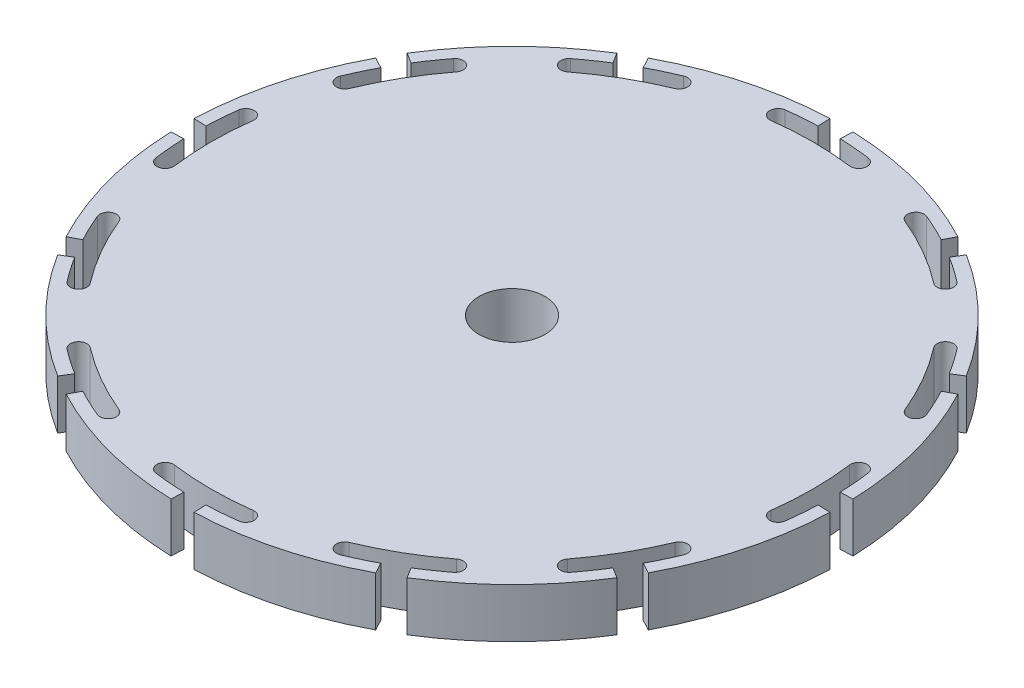
from build123d import *

# Parameters (mm, degrees)
SKETCH1_R         = 40
WHEEL_BLANK_DEPTH = 6
T_SLOT_DEPTH      = 57.885850613
CIRPATTERN1_COUNT = 12
SKETCH3_R         = 4
CENTER_HOLE_DEPTH = 6


with BuildPart() as part:
    # Sketch1 → Wheel Blank (new body)
    with BuildSketch(Plane(origin=(0, 0, 0), x_dir=(1, 0, 0), z_dir=(0, 1, 0))):
        Circle(SKETCH1_R)
    extrude(amount=WHEEL_BLANK_DEPTH)

    # Sketch2 → T-Slot (cut, through all)
    with BuildSketch(Plane(origin=(0, 0, 0), x_dir=(1, 0, 0), z_dir=(0, 1, 0))):
        with BuildLine():
            Line((-1.395979868, 39.975633081), (-1.343630623, 38.47654684))
            ThreePointArc((-1.343630623, 38.47654684), (-3.188115989, 38.367771846), (-5.0252584, 38.170627163))
            ThreePointArc((-5.0252584, 38.170627163), (-5.88617707, 37.048656109), (-4.764206016, 36.18773744))
            ThreePointArc((-4.764206016, 36.18773744), (0, 36.5), (4.764206016, 36.18773744))
            ThreePointArc((4.764206016, 36.18773744), (5.88617707, 37.048656109), (5.0252584, 38.170627163))
            ThreePointArc((5.0252584, 38.170627163), (3.188115989, 38.367771846), (1.343630623, 38.47654684))
            Line((1.343630623, 38.47654684), (1.395979868, 39.975633081))
            ThreePointArc((1.395979868, 39.975633081), (0, 40), (-1.395979868, 39.975633081))
        make_face()
    t_slot = extrude(amount=T_SLOT_DEPTH, mode=Mode.SUBTRACT)

    # CirPattern1: T-Slot ×12 about axis
    cirpattern1_axis = Axis((0, 6, 0), (0, -1, 0))
    for i in range(1, CIRPATTERN1_COUNT):
        add(t_slot.rotate(cirpattern1_axis, i * 360 / CIRPATTERN1_COUNT), mode=Mode.SUBTRACT)

    # Sketch3 → Center Hole (cut)
    with BuildSketch(Plane(origin=(0, 0, 0), x_dir=(1, 0, 0), z_dir=(0, 1, 0))):
        Circle(SKETCH3_R)
    extrude(amount=CENTER_HOLE_DEPTH, mode=Mode.SUBTRACT)


solid = part.part
